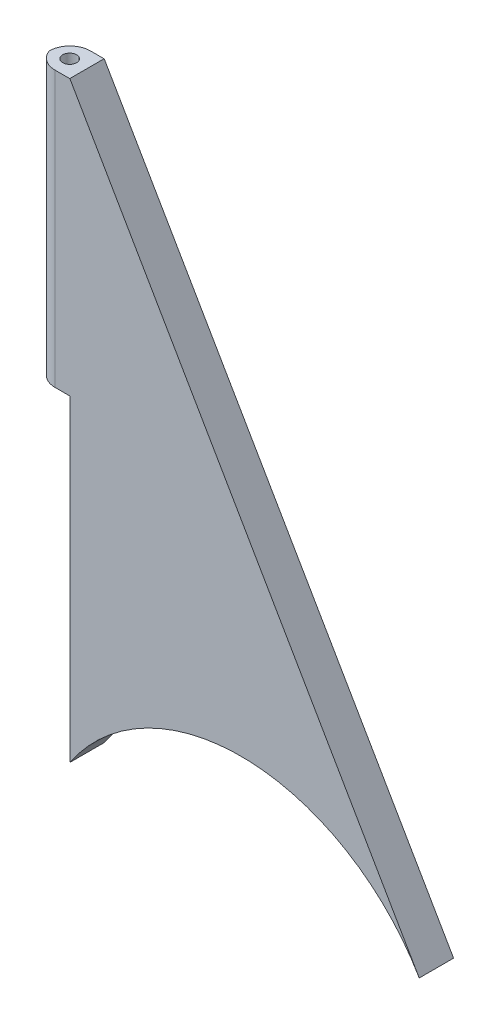
from build123d import *

# Parameters (mm, degrees)
BOSS_EXTRU_1_DEPTH      = 5
ESQUISSE9_W             = 5
ESQUISSE9_H             = 5
BOSS_EXTRU_3_DEPTH      = 40
ESQUISSE11_R            = 1.009332427
ENL_V_MAT_EXTRU_2_DEPTH = 40
CONG_1_R                = 3
CONG_2_R                = 3


with BuildPart() as part:
    # Esquisse1 → Boss.-Extru.1 (new body)
    with BuildSketch(Plane.XY):
        with BuildLine():
            Line((26.025021052, -0.447992933), (-24.829805977, 87.508811894))
            Line((-24.829805977, 87.508811894), (-24.829805977, 1.293439737))
            ThreePointArc((-24.829805977, 1.293439737), (1.080284786, 14.518282983), (26.025021052, -0.447992933))
        make_face()
    extrude(amount=BOSS_EXTRU_1_DEPTH)

    # Esquisse9 → Boss.-Extru.3 (add)
    with BuildSketch(Plane(origin=(0, 87.489884498, 0), x_dir=(1, 0, 0), z_dir=(0, 1, 0))):
        with Locations((-27.329805977, -2.5)):
            Rectangle(ESQUISSE9_W, ESQUISSE9_H)
    extrude(amount=-BOSS_EXTRU_3_DEPTH)

    # Esquisse11 → Enlèv. mat.-Extru.2 (cut)
    with BuildSketch(Plane(origin=(0, 87.489884498, 0), x_dir=(1, 0, 0), z_dir=(0, 1, 0))):
        with Locations(Location((-27.353173819, -2.5, 0), (0, 0, 270))):
            Circle(ESQUISSE11_R)
    extrude(amount=-ENL_V_MAT_EXTRU_2_DEPTH, mode=Mode.SUBTRACT)

    # Congé1
    cong_1_edges = [part.edges().sort_by_distance(p)[0] for p in [
        (-29.829805977, 67.489884498, 0),
    ]]
    fillet(cong_1_edges, radius=CONG_1_R)

    # Congé2
    # the kernel refuses this fillet: 3 mm, written as the material it takes off along each edge
    with BuildSketch(Plane(origin=(-29.829805977, 94.56095231, 5), x_dir=(0, 0, -1), z_dir=(0, -1, 0))) as cong_2_piece_1:
        with BuildLine():
            CenterArc((3, 2.828427125), CONG_2_R, 180, 70.528779366)
            Line((0, 2.828427125), (-0.06, 2.828427125))
            Line((-0.06, 2.828427125), (-0.06, 0))
            Line((-0.06, 0), (0, -0.06))
            ThreePointArc((0, -0.06), (1, -0.06), (1.98, -0.056568542))
            Line((1.98, -0.056568542), (2, 0))
        make_face()
    extrude(amount=54.142135624, mode=Mode.SUBTRACT)


solid = part.part
